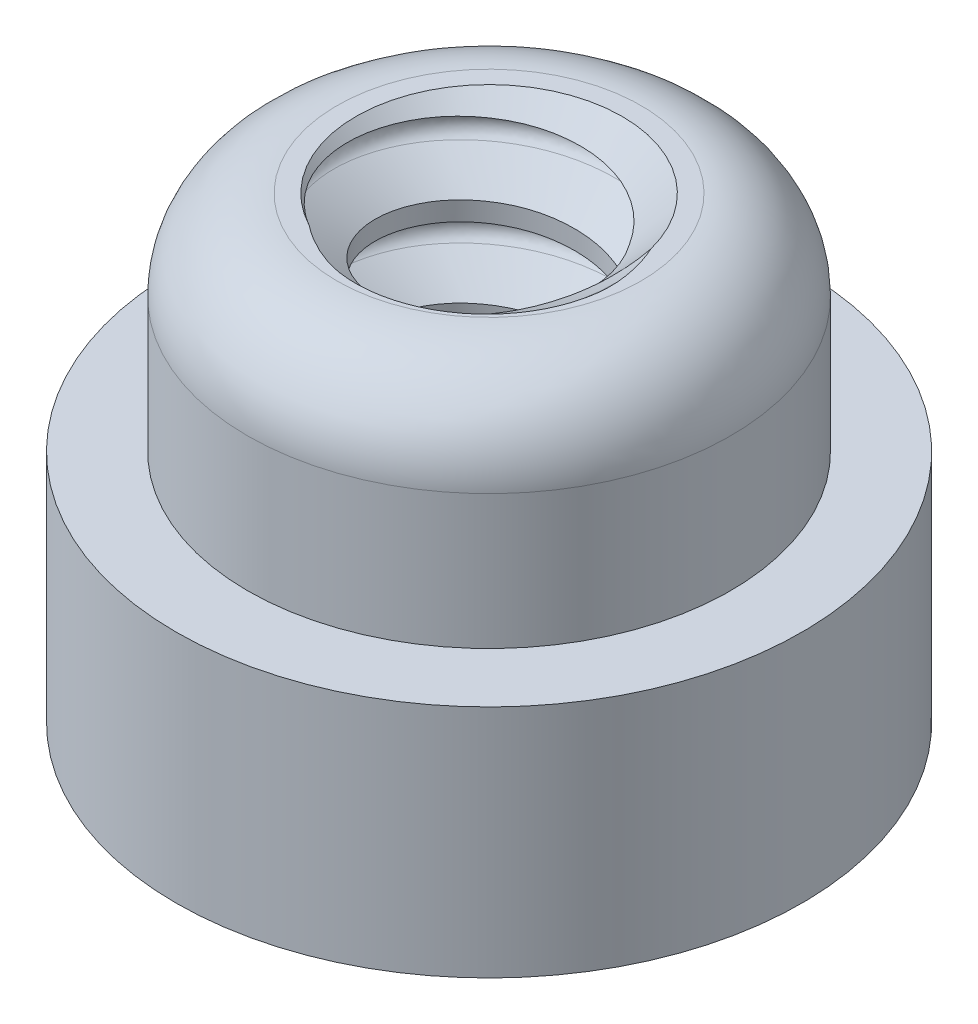
from build123d import *

# Parameters (mm, degrees)
SCHNITT_AUSTRAGUNG2_PITCH = 2


with BuildPart() as part:
    # Skizze1 → Rotation1 (revolve)
    with BuildSketch(Plane.XY, mode=Mode.PRIVATE) as rotation1_sk:
        with BuildLine():
            Line((7, 0), (2.25, 0))
            Line((2.25, 0), (2.25, 10.25))
            Line((2.25, 10.25), (3.4, 10.25))
            ThreePointArc((3.4, 10.25), (4.814213562, 9.664213562), (5.4, 8.25))
            Line((5.4, 8.25), (5.4, 5.25))
            Line((5.4, 5.25), (7, 5.25))
            Line((7, 5.25), (7, 0))
        make_face()
    revolve(rotation1_sk.sketch.rotate(Axis((0, 12.455425303, 0), (0, -1, 0)), 90), axis=Axis((0, 12.455425303, 0), (0, -1, 0)))

    # Schnitt-Austragung2: the profile of Skizze3 profile screwed along a right-hand helix of 8 turns, 10 arcs to a turn; built about Z, then put on its axis
    schnitt_austragung2_z = Axis((0, 0, 0), (0, 0, 1))
    schnitt_austragung2_corners = [(2.2497, 0, -1.575292263), (3.164093118, 0, -1.04736715), (3.314093118, 0, -0.787559529), (3.164093118, 0, -0.527751908), (2.2497, 0, 0.000173205)]
    with BuildLine(mode=Mode.PRIVATE) as schnitt_austragung2_profile:
        Line(schnitt_austragung2_corners[0], schnitt_austragung2_corners[1])
        Line(schnitt_austragung2_corners[3], schnitt_austragung2_corners[4])
        Line(schnitt_austragung2_corners[4], schnitt_austragung2_corners[0])
        ThreePointArc((3.164093118, 0, -1.04736715), (3.273900739, 0, -0.937559529), (3.314093118, 0, -0.787559529))
        ThreePointArc((3.314093118, 0, -0.787559529), (3.273900739, 0, -0.637559529), (3.164093118, 0, -0.527751908))
    schnitt_austragung2_cap = Face(schnitt_austragung2_profile.wire())
    schnitt_austragung2_arcs = [((3.164093118, 0, -1.04736715), (3.314093118, 0, -0.96076461), (3.314093118, 0, -0.787559529), (1, 0.8660254037844367, 1)), ((3.314093118, 0, -0.787559529), (3.314093118, 0, -0.614354448), (3.164093118, 0, -0.527751908), (1, 0.8660254037844367, 1))]  # start, shoulder, end, weights
    schnitt_austragung2_turn_angles = [0, 18, 36, 54, 72, 90, 108, 126, 144, 162, 180, 198, 216, 234, 252, 270, 288, 306, 324, 342, 360]
    schnitt_austragung2_turn_weights = [1, 0.9510565162951535, 1, 0.9510565162951535, 1, 0.9510565162951535, 1, 0.9510565162951535, 1, 0.9510565162951535, 1, 0.9510565162951535, 1, 0.9510565162951535, 1, 0.9510565162951535, 1, 0.9510565162951535, 1, 0.9510565162951535, 1]
    schnitt_austragung2_turn_rails = [Edge.make_bspline([Vector(p[0], p[1], 0).rotate(schnitt_austragung2_z, schnitt_austragung2_turn_angles[k]) / schnitt_austragung2_turn_weights[k] + Vector(0, 0, p[2] + SCHNITT_AUSTRAGUNG2_PITCH * schnitt_austragung2_turn_angles[k] / 360) for k in range(21)], [0, 0, 0, 1, 1, 2, 2, 3, 3, 4, 4, 5, 5, 6, 6, 7, 7, 8, 8, 9, 9, 10, 10, 10], 2, schnitt_austragung2_turn_weights) for p in schnitt_austragung2_corners]
    schnitt_austragung2_turn_sides = [*[Face.make_surface_from_curves(schnitt_austragung2_turn_rails[p[0]], schnitt_austragung2_turn_rails[p[1]]) for p in [(0, 1), (3, 4), (4, 0)]], *[Face.make_bezier_surface([[Vector(p[j][0], p[j][1], 0).rotate(schnitt_austragung2_z, schnitt_austragung2_turn_angles[2 * i + k]) / schnitt_austragung2_turn_weights[2 * i + k] + Vector(0, 0, p[j][2] + SCHNITT_AUSTRAGUNG2_PITCH * schnitt_austragung2_turn_angles[2 * i + k] / 360) for k in range(3)] for j in range(3)], [[p[3][j] * schnitt_austragung2_turn_weights[2 * i + k] for k in range(3)] for j in range(3)]) for p in schnitt_austragung2_arcs for i in range(10)]]
    schnitt_austragung2 = Plane(origin=(0, 10.25, 0), x_dir=(0, 0, -1), z_dir=(0, -1, 0)) * Solid(Shell([*[p.moved(Location((0, 0, SCHNITT_AUSTRAGUNG2_PITCH * i))) for i in range(8) for p in schnitt_austragung2_turn_sides], schnitt_austragung2_cap, schnitt_austragung2_cap.rotate(schnitt_austragung2_z, 2880).moved(Location((0, 0, SCHNITT_AUSTRAGUNG2_PITCH * 2880 / 360)))]))
    add(schnitt_austragung2, mode=Mode.SUBTRACT)

    # Skizze4 → Schnitt-Rotation1 (revolve, cut)
    with BuildSketch(Plane(origin=(0, 0, 0), x_dir=(0, 0, -1), z_dir=(1, 0, 0))):
        Polygon((-3.289959824, 10.561811083), (-1.76570827, 9.037559529), (-0.284845002, 9.037559529), (-0.284845002, 10.965993775), align=None)
    revolve(axis=Axis((0, 0, 0), (0, 1, 0)), mode=Mode.SUBTRACT)


solid = part.part
